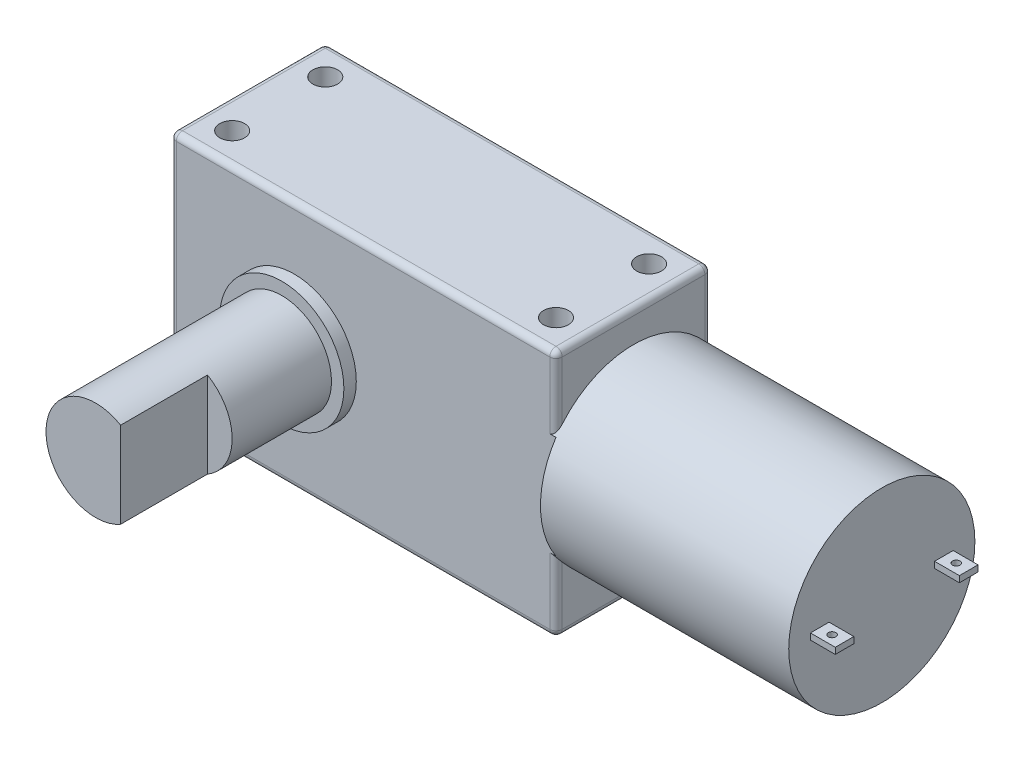
from build123d import *

# Parameters (mm, degrees)
SKETCH_1_W          = 50
SKETCH_1_H          = 30
EXTRUDE_1_DEPTH     = 25
SKETCH_2_R          = 5
EXTRUDE_2_DEPTH     = 1
SKETCH_3_R          = 4
EXTRUDE_3_DEPTH     = 15
SKETCH_6_W          = 125.650571392
SKETCH_6_H          = 76.942116616
SKETCH_6_W_2        = 31.088556847
SKETCH_6_H_2        = 20
CUT_EXTRUDE_1_DEPTH = 39.405728739
SKETCH_7_W          = 12.5
SKETCH_7_H          = 20
CUT_EXTRUDE_2_DEPTH = 53.416584845
SKETCH_8_R          = 7.5
EXTRUDE_5_DEPTH     = 20
SKETCH_9_W          = 1.5
SKETCH_9_H          = 0.5
EXTRUDE_6_DEPTH     = 2
SKETCH_10_R         = 0.3
CUT_EXTRUDE_3_DEPTH = 2
FILLET_1_R          = 0.5
CUT_EXTRUDE_START   = -7
CUT_EXTRUDE_4_DEPTH = 7
SKETCH_12_R         = 1
CUT_EXTRUDE_5_DEPTH = 54.572073189


with BuildPart() as part:
    # 草图1 → 凸台-拉伸1 (new body)
    with BuildSketch(Plane.XY):
        Rectangle(SKETCH_1_W, SKETCH_1_H)
    extrude(amount=EXTRUDE_1_DEPTH)

    # 草图2 → 凸台-拉伸2 (add)
    with BuildSketch(Plane.XY.offset(25)):
        with Locations((-15, 0)):
            Circle(SKETCH_2_R)
    extrude(amount=EXTRUDE_2_DEPTH)

    # 草图3 → 凸台-拉伸3 (add)
    with BuildSketch(Plane.XY.offset(26)):
        with Locations((-15, 0)):
            Circle(SKETCH_3_R)
    extrude(amount=EXTRUDE_3_DEPTH)

    # 草图6 → 切除-拉伸1 (cut, through all)
    with BuildSketch(Plane.XY.offset(25)):
        with Locations((-32.975192835, 18.238730024)):
            Rectangle(SKETCH_6_W, SKETCH_6_H)
        with Locations((-9.455721577, 0)):
            Rectangle(SKETCH_6_W_2, SKETCH_6_H_2, mode=Mode.SUBTRACT)
    extrude(amount=-CUT_EXTRUDE_1_DEPTH, mode=Mode.SUBTRACT)

    # 草图7 → 切除-拉伸2 (cut, through all)
    with BuildSketch(Plane(origin=(6.088556847, 0, 0), x_dir=(0, 0, -1), z_dir=(1, 0, 0))):
        with Locations((-6.25, 0)):
            Rectangle(SKETCH_7_W, SKETCH_7_H)
    extrude(amount=-CUT_EXTRUDE_2_DEPTH, mode=Mode.SUBTRACT)

    # 草图8 → 凸台-拉伸5 (add)
    with BuildSketch(Plane(origin=(6.088556847, 0, 0), x_dir=(0, 0, -1), z_dir=(1, 0, 0))):
        with Locations(Location((-18.75, 0, 0), (0, 0, 146.442690238))):
            Circle(SKETCH_8_R)
    extrude(amount=EXTRUDE_5_DEPTH)

    # 草图9 → 凸台-拉伸6 (add)
    with BuildSketch(Plane(origin=(26.088556847, 0, 0), x_dir=(0, 0, -1), z_dir=(1, 0, 0))):
        with Locations((-23.75, 0)):
            Rectangle(SKETCH_9_W, SKETCH_9_H)
        with Locations((-13.75, 0)):
            Rectangle(SKETCH_9_W, SKETCH_9_H)
    extrude(amount=EXTRUDE_6_DEPTH)

    # 草图10 → 切除-拉伸3 (cut)
    with BuildSketch(Plane.XZ.offset(0.25)):
        with Locations(Location((27.088556847, 23.75, 0), (0, 0, 270))):
            Circle(SKETCH_10_R)
        with Locations(Location((27.088556847, 13.75, 0), (0, 0, 270))):
            Circle(SKETCH_10_R)
    extrude(amount=-CUT_EXTRUDE_3_DEPTH, mode=Mode.SUBTRACT)

    # 圆角1
    # the kernel refuses this fillet: 0.5 mm, written as the material it takes off along each edge
    with BuildSketch(Plane(origin=(-24.5, -9.5, 24.5), x_dir=(0, 0, 1), z_dir=(-1, 0, 0))) as fillet_1_piece_1_section:
        Polygon((0, 0), (FILLET_1_R * 1.02, 0), (FILLET_1_R * 1.02, -FILLET_1_R * 1.02), (0, -FILLET_1_R * 1.02), align=None)
    fillet_1_piece_1 = extrude(amount=FILLET_1_R * 1.02, mode=Mode.PRIVATE)
    fillet_1_piece_1 = fillet_1_piece_1 - Plane(origin=(-24.5, -9.5, 24.5), x_dir=(0, 0.7071067811865475, -0.7071067811865475), z_dir=(-1, 0, 0)) * Sphere(FILLET_1_R, mode=Mode.PRIVATE)
    add(fillet_1_piece_1, mode=Mode.SUBTRACT)
    with BuildSketch(Plane(origin=(-24.5, 9.5, 24.5), x_dir=(0, 1, 0), z_dir=(-1, 0, 0))) as fillet_1_piece_2_section:
        Polygon((0, 0), (FILLET_1_R * 1.02, 0), (FILLET_1_R * 1.02, -FILLET_1_R * 1.02), (0, -FILLET_1_R * 1.02), align=None)
    fillet_1_piece_2 = extrude(amount=FILLET_1_R * 1.02, mode=Mode.PRIVATE)
    fillet_1_piece_2 = fillet_1_piece_2 - Plane(origin=(-24.5, 9.5, 24.5), x_dir=(0, -0.7071067811865475, -0.7071067811865475), z_dir=(-1, 0, 0)) * Sphere(FILLET_1_R, mode=Mode.PRIVATE)
    add(fillet_1_piece_2, mode=Mode.SUBTRACT)
    with BuildSketch(Plane(origin=(5.588556847, 9.5, 24.5), x_dir=(0, 0, 1), z_dir=(0, 1, 0))) as fillet_1_piece_3_section:
        Polygon((0, 0), (FILLET_1_R * 1.02, 0), (FILLET_1_R * 1.02, FILLET_1_R * 1.02), (0, FILLET_1_R * 1.02), align=None)
    fillet_1_piece_3 = extrude(amount=FILLET_1_R * 1.02, mode=Mode.PRIVATE)
    fillet_1_piece_3 = fillet_1_piece_3 - Plane(origin=(5.588556847, 9.5, 24.5), x_dir=(-0.7071067811865475, 0, -0.7071067811865475), z_dir=(0, 1, 0)) * Sphere(FILLET_1_R, mode=Mode.PRIVATE)
    add(fillet_1_piece_3, mode=Mode.SUBTRACT)
    with BuildSketch(Plane(origin=(5.588556847, -9.5, 24.5), x_dir=(0, -1, 0), z_dir=(0, 0, 1))) as fillet_1_piece_4_section:
        Polygon((0, 0), (FILLET_1_R * 1.02, 0), (FILLET_1_R * 1.02, FILLET_1_R * 1.02), (0, FILLET_1_R * 1.02), align=None)
    fillet_1_piece_4 = extrude(amount=FILLET_1_R * 1.02, mode=Mode.PRIVATE)
    fillet_1_piece_4 = fillet_1_piece_4 - Plane(origin=(5.588556847, -9.5, 24.5), x_dir=(-0.7071067811865475, 0.7071067811865476, 0), z_dir=(0, 0, 1)) * Sphere(FILLET_1_R, mode=Mode.PRIVATE)
    add(fillet_1_piece_4, mode=Mode.SUBTRACT)
    with BuildSketch(Plane(origin=(-24.5, -9.5, 13), x_dir=(0, 0, -1), z_dir=(-1, 0, 0))) as fillet_1_piece_5_section:
        Polygon((0, 0), (FILLET_1_R * 1.02, 0), (FILLET_1_R * 1.02, FILLET_1_R * 1.02), (0, FILLET_1_R * 1.02), align=None)
    fillet_1_piece_5 = extrude(amount=FILLET_1_R * 1.02, mode=Mode.PRIVATE)
    fillet_1_piece_5 = fillet_1_piece_5 - Plane(origin=(-24.5, -9.5, 13), x_dir=(0, 0.7071067811865475, 0.7071067811865475), z_dir=(-1, 0, 0)) * Sphere(FILLET_1_R, mode=Mode.PRIVATE)
    add(fillet_1_piece_5, mode=Mode.SUBTRACT)
    with BuildSketch(Plane(origin=(5.588556847, -9.5, 13), x_dir=(0, -1, 0), z_dir=(0, 0, -1))) as fillet_1_piece_6_section:
        Polygon((0, 0), (FILLET_1_R * 1.02, 0), (FILLET_1_R * 1.02, -FILLET_1_R * 1.02), (0, -FILLET_1_R * 1.02), align=None)
    fillet_1_piece_6 = extrude(amount=FILLET_1_R * 1.02, mode=Mode.PRIVATE)
    fillet_1_piece_6 = fillet_1_piece_6 - Plane(origin=(5.588556847, -9.5, 13), x_dir=(-0.7071067811865475, 0.7071067811865476, 0), z_dir=(0, 0, -1)) * Sphere(FILLET_1_R, mode=Mode.PRIVATE)
    add(fillet_1_piece_6, mode=Mode.SUBTRACT)
    with BuildSketch(Plane(origin=(5.588556847, 9.5, 13), x_dir=(0, 1, 0), z_dir=(0, 0, -1))) as fillet_1_piece_7_section:
        Polygon((0, 0), (FILLET_1_R * 1.02, 0), (FILLET_1_R * 1.02, FILLET_1_R * 1.02), (0, FILLET_1_R * 1.02), align=None)
    fillet_1_piece_7 = extrude(amount=FILLET_1_R * 1.02, mode=Mode.PRIVATE)
    fillet_1_piece_7 = fillet_1_piece_7 - Plane(origin=(5.588556847, 9.5, 13), x_dir=(-0.7071067811865475, -0.7071067811865476, 0), z_dir=(0, 0, -1)) * Sphere(FILLET_1_R, mode=Mode.PRIVATE)
    add(fillet_1_piece_7, mode=Mode.SUBTRACT)
    with BuildSketch(Plane(origin=(-24.5, 9.5, 13), x_dir=(0, 0, -1), z_dir=(-1, 0, 0))) as fillet_1_piece_8_section:
        Polygon((0, 0), (FILLET_1_R * 1.02, 0), (FILLET_1_R * 1.02, -FILLET_1_R * 1.02), (0, -FILLET_1_R * 1.02), align=None)
    fillet_1_piece_8 = extrude(amount=FILLET_1_R * 1.02, mode=Mode.PRIVATE)
    fillet_1_piece_8 = fillet_1_piece_8 - Plane(origin=(-24.5, 9.5, 13), x_dir=(0, -0.7071067811865475, 0.7071067811865475), z_dir=(-1, 0, 0)) * Sphere(FILLET_1_R, mode=Mode.PRIVATE)
    add(fillet_1_piece_8, mode=Mode.SUBTRACT)
    with BuildSketch(Plane(origin=(-25, -9.5, 25), x_dir=(0, 0, -1), z_dir=(0, 1, 0)), Plane(origin=(-25, 9.5, 12.5), x_dir=(0, 0, 1), z_dir=(0, -1, 0))) as fillet_1_piece_9:
        with BuildLine():
            CenterArc((FILLET_1_R, -FILLET_1_R), FILLET_1_R, 90, 90)
            Line((0, -FILLET_1_R), (0, 0))
            Line((0, 0), (FILLET_1_R, 0))
        make_face()
    extrude(amount=19, mode=Mode.SUBTRACT)
    with BuildSketch(Plane(origin=(-24.5, 10, 25), x_dir=(0, 0, -1), z_dir=(1, 0, 0)), Plane(origin=(5.588556847, -10, 12.5), x_dir=(0, 1, 0), z_dir=(-1, 0, 0))) as fillet_1_piece_10:
        with BuildLine():
            CenterArc((FILLET_1_R, -FILLET_1_R), FILLET_1_R, 90, 90)
            Line((0, -FILLET_1_R), (0, 0))
            Line((0, 0), (FILLET_1_R, 0))
        make_face()
    extrude(amount=30.088556847, mode=Mode.SUBTRACT)
    with BuildSketch(Plane(origin=(6.088556847, -2.895780988, 25), x_dir=(-1, 0, 0), z_dir=(0, -1, 0))) as fillet_1_piece_11_section:
        with BuildLine():
            CenterArc((FILLET_1_R, FILLET_1_R), FILLET_1_R, 180, 90)
            Line((0, FILLET_1_R), (0, 0))
            Line((0, 0), (FILLET_1_R, 0))
        make_face()
    fillet_1_piece_11 = extrude(amount=6.604219012, mode=Mode.PRIVATE)
    fillet_1_piece_11 = fillet_1_piece_11 - Plane(origin=(5.975472157, 0, 18.75), x_dir=(0, 0.5527707983937196, 0.8333333333325685), z_dir=(-1, 0, 0)) * Cylinder(7.5, 16, mode=Mode.PRIVATE)
    add(fillet_1_piece_11, mode=Mode.SUBTRACT)
    with BuildSketch(Plane(origin=(5.588556847, -10, 25), x_dir=(0, 1, 0), z_dir=(-1, 0, 0)), Plane(origin=(5.588556847, 10, 12.5), x_dir=(0, -1, 0), z_dir=(-1, 0, 0))) as fillet_1_piece_12:
        with BuildLine():
            CenterArc((FILLET_1_R, FILLET_1_R), FILLET_1_R, 180, 90)
            Line((0, FILLET_1_R), (0, 0))
            Line((0, 0), (FILLET_1_R, 0))
        make_face()
    extrude(amount=30.088556847, mode=Mode.SUBTRACT)
    with BuildSketch(Plane(origin=(-25, -10, 24.5), x_dir=(0, 1, 0), z_dir=(0, 0, -1)), Plane(origin=(6.088556847, -10, 24.5), x_dir=(-1, 0, 0), z_dir=(0, 0, -1))) as fillet_1_piece_13:
        with BuildLine():
            CenterArc((FILLET_1_R, FILLET_1_R), FILLET_1_R, 180, 90)
            Line((0, FILLET_1_R), (0, 0))
            Line((0, 0), (FILLET_1_R, 0))
        make_face()
    extrude(amount=11.5, mode=Mode.SUBTRACT)
    with BuildSketch(Plane(origin=(6.088556847, 10, 24.5), x_dir=(-1, 0, 0), z_dir=(0, 0, -1)), Plane(origin=(-25, 10, 24.5), x_dir=(0, -1, 0), z_dir=(0, 0, -1))) as fillet_1_piece_14:
        with BuildLine():
            CenterArc((FILLET_1_R, -FILLET_1_R), FILLET_1_R, 90, 90)
            Line((0, -FILLET_1_R), (0, 0))
            Line((0, 0), (FILLET_1_R, 0))
        make_face()
    extrude(amount=11.5, mode=Mode.SUBTRACT)
    with BuildSketch(Plane(origin=(6.088556847, 2.895780988, 12.5), x_dir=(-1, 0, 0), z_dir=(0, 1, 0))) as fillet_1_piece_15_section:
        with BuildLine():
            CenterArc((FILLET_1_R, FILLET_1_R), FILLET_1_R, 180, 90)
            Line((0, FILLET_1_R), (0, 0))
            Line((0, 0), (FILLET_1_R, 0))
        make_face()
    fillet_1_piece_15 = extrude(amount=6.604219012, mode=Mode.PRIVATE)
    fillet_1_piece_15 = fillet_1_piece_15 - Plane(origin=(5.975472139, 0, 18.75), x_dir=(0, 0.5527707983937196, 0.8333333333325685), z_dir=(-1, 0, 0)) * Cylinder(7.5, 16, mode=Mode.PRIVATE)
    add(fillet_1_piece_15, mode=Mode.SUBTRACT)
    with BuildSketch(Plane(origin=(6.088556847, -9.5, 12.5), x_dir=(-1, 0, 0), z_dir=(0, 1, 0))) as fillet_1_piece_16_section:
        with BuildLine():
            CenterArc((FILLET_1_R, FILLET_1_R), FILLET_1_R, 180, 90)
            Line((0, FILLET_1_R), (0, 0))
            Line((0, 0), (FILLET_1_R, 0))
        make_face()
    fillet_1_piece_16 = extrude(amount=6.604219012, mode=Mode.PRIVATE)
    fillet_1_piece_16 = fillet_1_piece_16 - Plane(origin=(5.97547253, 0, 18.75), x_dir=(0, 0.5527707983937196, 0.8333333333325685), z_dir=(-1, 0, 0)) * Cylinder(7.5, 16, mode=Mode.PRIVATE)
    add(fillet_1_piece_16, mode=Mode.SUBTRACT)
    with BuildSketch(Plane(origin=(6.088556847, 9.5, 25), x_dir=(-1, 0, 0), z_dir=(0, -1, 0))) as fillet_1_piece_17_section:
        with BuildLine():
            CenterArc((FILLET_1_R, FILLET_1_R), FILLET_1_R, 180, 90)
            Line((0, FILLET_1_R), (0, 0))
            Line((0, 0), (FILLET_1_R, 0))
        make_face()
    fillet_1_piece_17 = extrude(amount=6.604219012, mode=Mode.PRIVATE)
    fillet_1_piece_17 = fillet_1_piece_17 - Plane(origin=(5.975472488, 0, 18.75), x_dir=(0, 0.5527707983937196, 0.8333333333325685), z_dir=(-1, 0, 0)) * Cylinder(7.5, 16, mode=Mode.PRIVATE)
    add(fillet_1_piece_17, mode=Mode.SUBTRACT)

    # 草图11 → 切除-拉伸4 (cut)
    with BuildSketch(Plane.XY.offset(41).offset(CUT_EXTRUDE_START)):
        with BuildLine():
            Line((-12.989168341, 3.457825334), (-12.989168341, -3.457825334))
            ThreePointArc((-12.989168341, -3.457825334), (-11, 0), (-12.989168341, 3.457825334))
        make_face()
    extrude(amount=CUT_EXTRUDE_4_DEPTH, mode=Mode.SUBTRACT)

    # 草图12 → 切除-拉伸5 (cut, through all)
    with BuildSketch(Plane.XZ.offset(10)):
        with Locations((-22.5, 22.5)):
            Circle(SKETCH_12_R)
        with Locations((3.588556847, 22.5)):
            Circle(SKETCH_12_R)
        with Locations((-22.5, 15)):
            Circle(SKETCH_12_R)
        with Locations((3.588556847, 15)):
            Circle(SKETCH_12_R)
    extrude(amount=-CUT_EXTRUDE_5_DEPTH, mode=Mode.SUBTRACT)


solid = part.part
